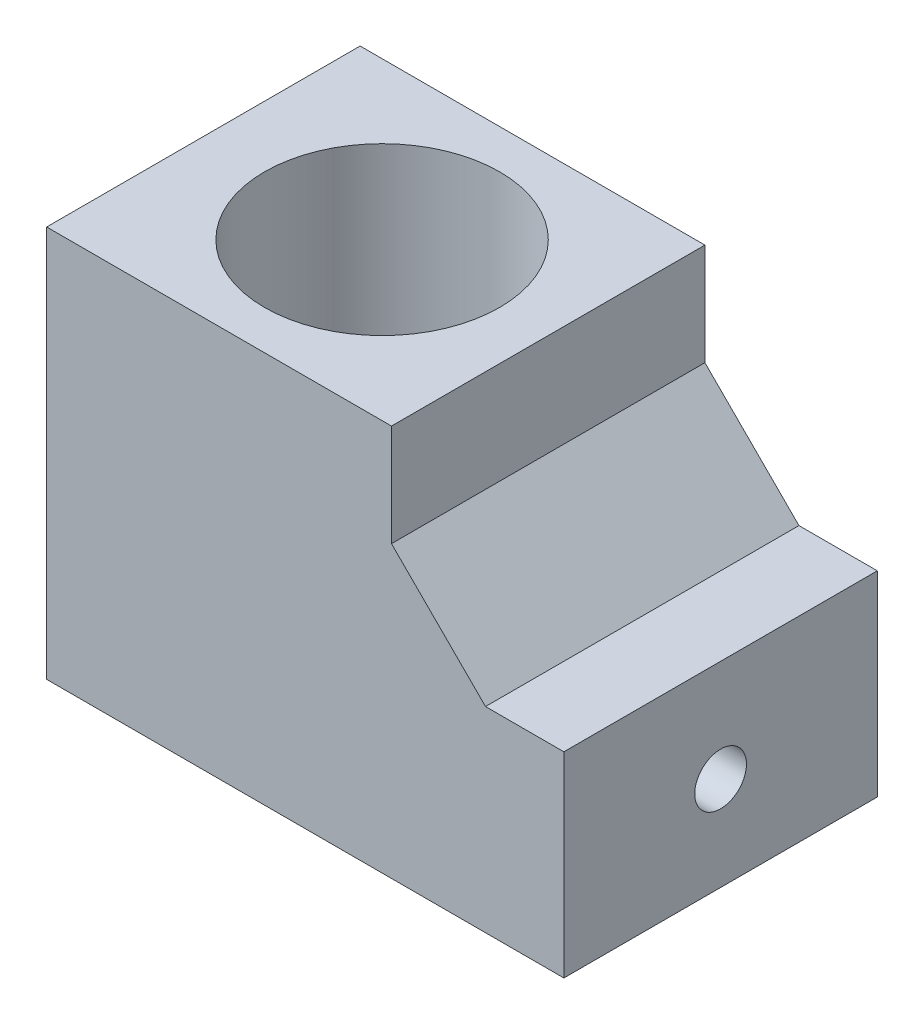
from build123d import *

# Parameters (mm, degrees)
ESTRUSIONE_ESTRUSIONE1_DEPTH = 20
SCHIZZO2_R                   = 7.5
TAGLIO_ESTRUSIONE1_DEPTH     = 46.97825573
FORO_FILETTATO_M4_1_D        = 3.3
FORO_FILETTATO_M4_1_DEPTH    = 10.1
FORO_FILETTATO_M4_1_TIP      = 0.991420021


with BuildPart() as part:
    # Schizzo1 → Estrusione-Estrusione1 (new body)
    with BuildSketch(Plane.XY):
        Polygon((0, 0), (33, 0), (33, 12.5), (28, 12.5), (22, 18.5), (22, 25), (0, 25), align=None)
    extrude(amount=-ESTRUSIONE_ESTRUSIONE1_DEPTH)

    # Schizzo2 → Taglio-Estrusione1 (cut, through all)
    with BuildSketch(Plane.XZ):
        with Locations((11.4, -10)):
            Circle(SCHIZZO2_R)
    extrude(amount=-TAGLIO_ESTRUSIONE1_DEPTH, mode=Mode.SUBTRACT)

    # Foro filettato M4-1
    with Locations(Plane(origin=(33, 0, 0), x_dir=(0, 0, -1), z_dir=(1, 0, 0))):
        with Locations((10, 6)):
            Hole(FORO_FILETTATO_M4_1_D / 2, depth=FORO_FILETTATO_M4_1_DEPTH)
            with Locations((0, 0, -(FORO_FILETTATO_M4_1_DEPTH + FORO_FILETTATO_M4_1_TIP / 2))):  # 118° drill point
                Cone(0, FORO_FILETTATO_M4_1_D / 2, FORO_FILETTATO_M4_1_TIP, mode=Mode.SUBTRACT)


solid = part.part
